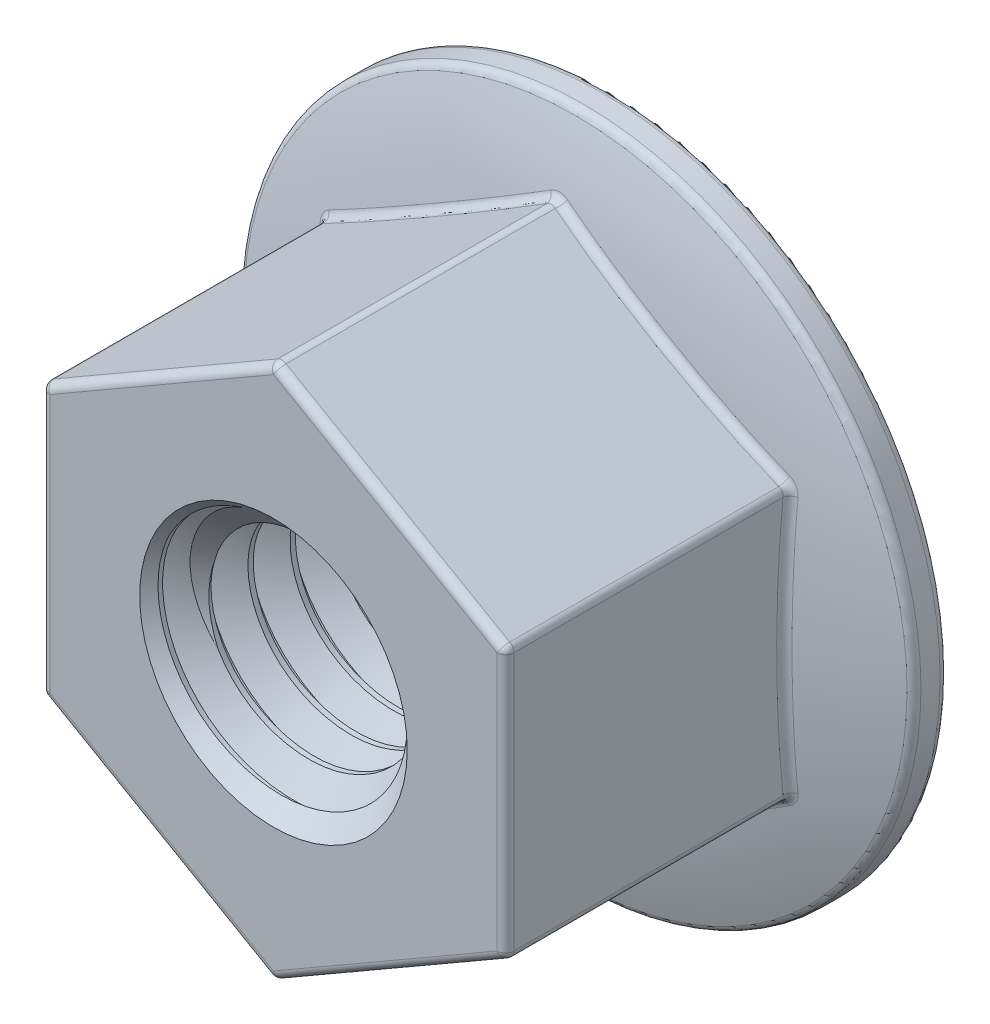
from build123d import *

# Parameters (mm, degrees)
SKETCH10_R          = 1.5
BOSS_EXTRUDE1_DEPTH = 4
FILLET1_R           = 0.1
SWEEP1_PITCH        = 0.5


with BuildPart() as part:
    # Sketch10 → Boss-Extrude1 (new body)
    with BuildSketch(Plane.XY):
        Polygon((0, 3.175426481), (-2.75, 1.58771324), (-2.75, -1.58771324), (0, -3.175426481), (2.75, -1.58771324), (2.75, 1.58771324), align=None)
        Circle(SKETCH10_R, mode=Mode.SUBTRACT)
    extrude(amount=-BOSS_EXTRUDE1_DEPTH)

    # Sketch11 → Revolve2 (revolve)
    with BuildSketch(Plane(origin=(0, 0, 0), x_dir=(0, 0, -1), z_dir=(1, 0, 0)), mode=Mode.PRIVATE) as revolve2_sk:
        with BuildLine():
            Line((3.6, 4), (4, 4))
            Line((4, 4), (4, 1.5))
            Line((4, 1.5), (3.2, 1.5))
            ThreePointArc((3.2, 1.5), (3.300631937, 2.76589889), (3.6, 4))
        make_face()
    revolve(revolve2_sk.sketch.rotate(Axis((0, 0, 0), (0, 0, -1)), 90), axis=Axis((0, 0, 0), (0, 0, -1)))

    # Fillet1
    fillet1_edges = [part.edges().sort_by_distance(p)[0] for p in [
        (-1.375, 2.38156986, 0),
        (-2.75, 1.58771324, -1.688562469),
        (-1.375, 2.38156986, -3.298104492),
        (0, 3.175426481, -1.688562469),
        (1.375, 2.38156986, 0),
        (1.375, 2.38156986, -3.298104492),
        (2.75, 1.58771324, -1.688562469),
        (2.75, 0, 0),
        (2.75, 0.794916368, -3.316708793),
        (2.75, -0.794916368, -3.316708793),
        (2.75, -1.58771324, -1.688562469),
        (1.375, -2.38156986, 0),
        (1.375, -2.38156986, -3.298104492),
        (0, -3.175426481, -1.688562469),
        (-1.375, -2.38156986, 0),
        (-1.375, -2.38156986, -3.298104492),
        (-2.75, -1.58771324, -1.688562469),
        (-2.75, 0, -3.298104492),
        (-4, 0, -3.6),
        (-4, 0, -4),
        (-2.75, 0, 0),
    ]]
    fillet(fillet1_edges, radius=FILLET1_R)

    # Sweep1: the profile of Sketch6 screwed along a left-hand helix of 9 turns, 6 arcs to a turn; built about Z, then put on its axis
    sweep1_z = Axis((0, 0, 0), (0, 0, 1))
    sweep1_corners = [(1.175240474, 0, -0.25), (1.175240474, 0, -0.1875), (1.527063294, 0, 0.015625), (1.527063294, 0, -0.453125)]
    with BuildLine(mode=Mode.PRIVATE) as sweep1_profile:
        Line(sweep1_corners[0], sweep1_corners[1])
        Line(sweep1_corners[1], sweep1_corners[2])
        Line(sweep1_corners[2], sweep1_corners[3])
        Line(sweep1_corners[3], sweep1_corners[0])
    sweep1_cap = Face(sweep1_profile.wire())
    sweep1_turn_angles = [0, -30, -60, -90, -120, -150, -180, -210, -240, -270, -300, -330, -360]
    sweep1_turn_weights = [1, 0.8660254037844387, 1, 0.8660254037844387, 1, 0.8660254037844387, 1, 0.8660254037844387, 1, 0.8660254037844387, 1, 0.8660254037844387, 1]
    sweep1_turn_rails = [Edge.make_bspline([Vector(p[0], p[1], 0).rotate(sweep1_z, sweep1_turn_angles[k]) / sweep1_turn_weights[k] + Vector(0, 0, p[2] + -SWEEP1_PITCH * sweep1_turn_angles[k] / 360) for k in range(13)], [0, 0, 0, 1, 1, 2, 2, 3, 3, 4, 4, 5, 5, 6, 6, 6], 2, sweep1_turn_weights) for p in sweep1_corners]
    sweep1_turn_sides = [Face.make_surface_from_curves(sweep1_turn_rails[p[0]], sweep1_turn_rails[p[1]]) for p in [(0, 1), (1, 2), (2, 3), (3, 0)]]
    sweep1 = Plane(origin=(0, 0, 0), x_dir=(0, 1, 0), z_dir=(0, 0, -1)) * Solid(Shell([*[p.moved(Location((0, 0, SWEEP1_PITCH * i))) for i in range(9) for p in sweep1_turn_sides], sweep1_cap, sweep1_cap.rotate(sweep1_z, -3240).moved(Location((0, 0, -SWEEP1_PITCH * -3240 / 360)))]))
    add(sweep1)

    # Sketch12 → Cut-Revolve2 (revolve, cut)
    with BuildSketch(Plane(origin=(0, 0, 0), x_dir=(0, 0, -1), z_dir=(1, 0, 0)), mode=Mode.PRIVATE) as cut_revolve2_sk:
        Polygon((-0.21875, 1.804126588), (-1.09375, 1.804126588), (-1.09375, 0), (0.464262702, 0), (0.464262702, 1.121113886), align=None)
        Polygon((3.535737298, 1.121113886), (3.535737298, 0), (5.09375, 0), (5.09375, 1.804126588), (4.21875, 1.804126588), align=None)
    revolve(cut_revolve2_sk.sketch.rotate(Axis((0, 0, 0), (0, 0, -1)), 159.882800223), axis=Axis((0, 0, 0), (0, 0, -1)), mode=Mode.SUBTRACT)


solid = part.part
